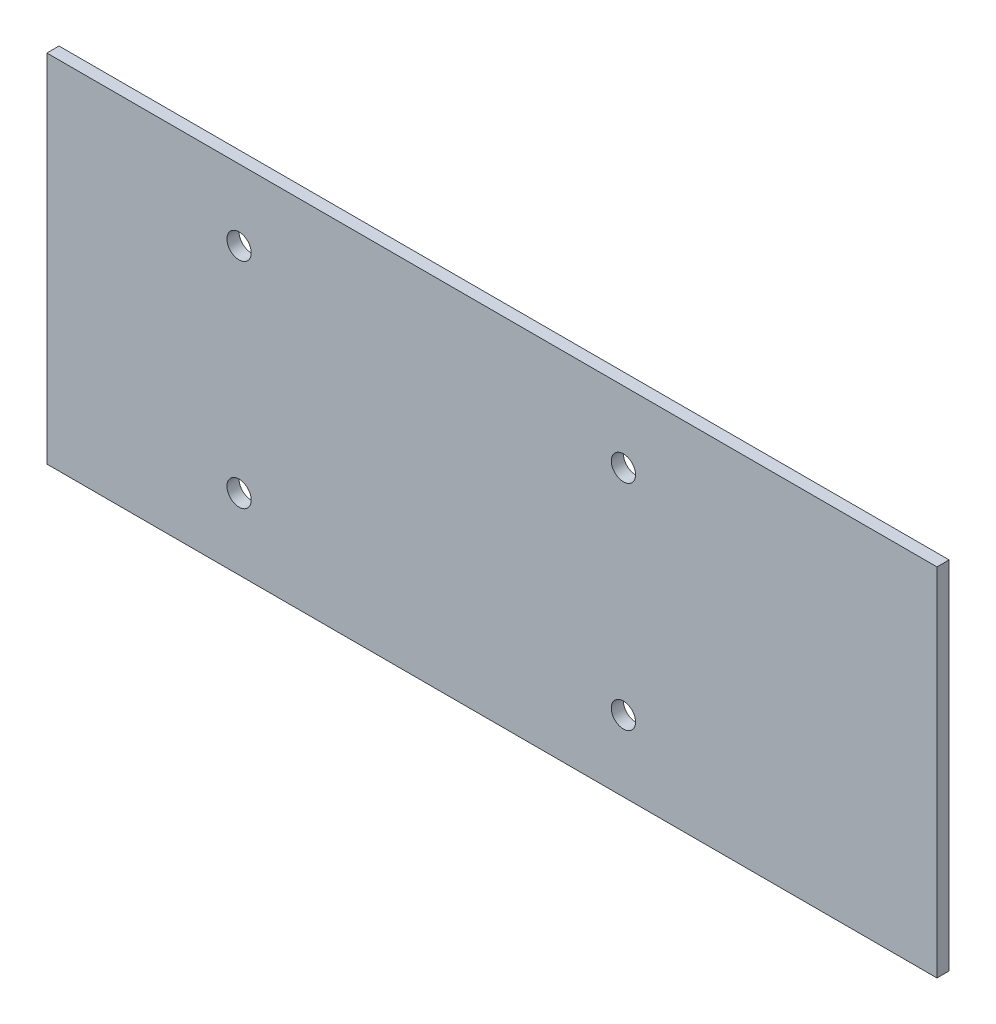
from build123d import *

# Parameters (mm, degrees)
SKETCH1_W           = 395
SKETCH1_H           = 176
SKETCH1_R           = 6
BOSS_EXTRUDE1_DEPTH = 6
SKETCH2_W           = 6
SKETCH2_H           = 176
BOSS_EXTRUDE2_DEPTH = 45


with BuildPart() as part:
    # Sketch1 → Boss-Extrude1 (new body)
    with BuildSketch(Plane.XY):
        with Locations((-197.5, 0)):
            Rectangle(SKETCH1_W, SKETCH1_H)
        with Locations((-345, 52.92)):
            Circle(SKETCH1_R, mode=Mode.SUBTRACT)
        with Locations((-155, 52.92)):
            Circle(SKETCH1_R, mode=Mode.SUBTRACT)
        with Locations((-155, -52.92)):
            Circle(SKETCH1_R, mode=Mode.SUBTRACT)
        with Locations((-345, -52.92)):
            Circle(SKETCH1_R, mode=Mode.SUBTRACT)
    extrude(amount=BOSS_EXTRUDE1_DEPTH)

    # Sketch2 → Boss-Extrude2 (add)
    with BuildSketch(Plane.ZY.offset(395)):
        with Locations((3, 0)):
            Rectangle(SKETCH2_W, SKETCH2_H)
    extrude(amount=BOSS_EXTRUDE2_DEPTH)


solid = part.part
